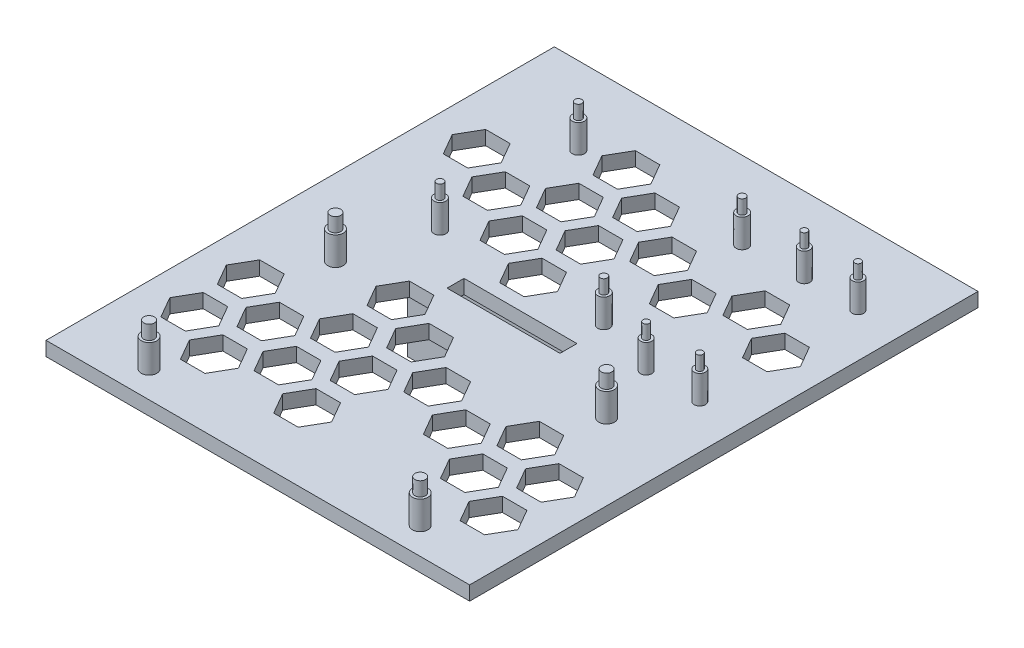
from build123d import *

# Parameters (mm, degrees)
ESQUISSE1_W                     = 62
ESQUISSE1_H                     = 12
ESQUISSE1_W_2                   = 58
ESQUISSE1_H_2                   = 8
BOSS_EXTRU_1_DEPTH              = 20
ESQUISSE2_R                     = 3.175
ENL_V_MAT_EXTRU_1_DEPTH         = 39.794329483
ESQUISSE3_W                     = 150
ESQUISSE3_H                     = 180
BOSS_EXTRU_2_DEPTH              = 5
ENL_V_MAT_EXTRU_3_REACH         = 120.849
ESQUISSE6_W                     = 40
ESQUISSE6_H                     = 6
ESQUISSE11_R                    = 2.75
BOSS_EXTRU_3_DEPTH              = 10
ESQUISSE13_R                    = 2
BOSS_EXTRU_4_DEPTH              = 10
ESQUISSE12_R                    = 2.125
BOSS_EXTRU_5_DEPTH              = 10
ESQUISSE10_R                    = 1.875
BOSS_EXTRU_6_DEPTH              = 15
ESQUISSE9_R                     = 1.125
BOSS_EXTRU_7_DEPTH              = 15
ESQUISSE8_R                     = 1.25
BOSS_EXTRU_8_DEPTH              = 15
ENL_V_MAT_EXTRU_4_DEPTH         = 120.791485507
R_P_TITION_LIN_AIRE1_COUNT      = 7
R_P_TITION_LIN_AIRE1_PITCH      = 20
R_P_TITION_LIN_AIRE1_COUNT_DIR2 = 4
R_P_TITION_LIN_AIRE1_PITCH_DIR2 = 33


with BuildPart() as part:
    # Esquisse1 → Boss.-Extru.1 (new body)
    with BuildSketch(Plane(origin=(0, 0, 0), x_dir=(1, 0, 0), z_dir=(0, 1, 0))):
        Rectangle(ESQUISSE1_W, ESQUISSE1_H)
        Rectangle(ESQUISSE1_W_2, ESQUISSE1_H_2, mode=Mode.SUBTRACT)
    extrude(amount=BOSS_EXTRU_1_DEPTH)

    # Esquisse2 → Enlèv. mat.-Extru.1 (cut, through all)
    with BuildSketch(Plane.XY.offset(6)):
        with Locations((0, 8)):
            Circle(ESQUISSE2_R)
    extrude(amount=-ENL_V_MAT_EXTRU_1_DEPTH, mode=Mode.SUBTRACT)

    # Esquisse3 → Boss.-Extru.2 (add)
    with BuildSketch(Plane(origin=(0, 20, 0), x_dir=(1, 0, 0), z_dir=(0, 1, 0))):
        Rectangle(ESQUISSE3_W, ESQUISSE3_H)
    extrude(amount=BOSS_EXTRU_2_DEPTH)

    # Esquisse6 → Enlèv. mat.-Extru.3 (cut, up to next)
    with BuildSketch(Plane(origin=(0, 20, 0), x_dir=(-1, 0, 0), z_dir=(0, -1, 0)), mode=Mode.PRIVATE) as enl_v_mat_extru_3_sk1:
        Rectangle(ESQUISSE6_W, ESQUISSE6_H)
    enl_v_mat_extru_3_tool1 = extrude(enl_v_mat_extru_3_sk1.sketch, amount=-ENL_V_MAT_EXTRU_3_REACH, mode=Mode.PRIVATE) & part.part
    add(enl_v_mat_extru_3_tool1.solids().sort_by_distance((0, 20, 0))[0], mode=Mode.SUBTRACT)

    # Esquisse11 → Boss.-Extru.3 (add)
    with BuildSketch(Plane(origin=(0, 25, 0), x_dir=(1, 0, 0), z_dir=(0, 1, 0))):
        with Locations((-48, -14.5)):
            Circle(ESQUISSE11_R)
        with Locations((-48, -80.5)):
            Circle(ESQUISSE11_R)
        with Locations((48, -14.5)):
            Circle(ESQUISSE11_R)
        with Locations((48, -80.5)):
            Circle(ESQUISSE11_R)
    extrude(amount=BOSS_EXTRU_3_DEPTH)

    # Esquisse13 → Boss.-Extru.4 (add)
    with BuildSketch(Plane(origin=(0, 25, 0), x_dir=(1, 0, 0), z_dir=(0, 1, 0))):
        with Locations((59.5, 7)):
            Circle(ESQUISSE13_R)
        with Locations((59.5, 63)):
            Circle(ESQUISSE13_R)
        with Locations((40.5, 7)):
            Circle(ESQUISSE13_R)
        with Locations((40.5, 63)):
            Circle(ESQUISSE13_R)
    extrude(amount=BOSS_EXTRU_4_DEPTH)

    # Esquisse12 → Boss.-Extru.5 (add)
    with BuildSketch(Plane(origin=(0, 25, 0), x_dir=(1, 0, 0), z_dir=(0, 1, 0))):
        with Locations((19, 62.5)):
            Circle(ESQUISSE12_R)
        with Locations((19, 13.5)):
            Circle(ESQUISSE12_R)
        with Locations((-39, 62.5)):
            Circle(ESQUISSE12_R)
        with Locations((-39, 13.5)):
            Circle(ESQUISSE12_R)
    extrude(amount=BOSS_EXTRU_5_DEPTH)

    # Esquisse10 → Boss.-Extru.6 (add)
    with BuildSketch(Plane(origin=(0, 25, 0), x_dir=(1, 0, 0), z_dir=(0, 1, 0))):
        with Locations((-48, -14.5)):
            Circle(ESQUISSE10_R)
        with Locations((48, -14.5)):
            Circle(ESQUISSE10_R)
        with Locations((-48, -80.5)):
            Circle(ESQUISSE10_R)
        with Locations((48, -80.5)):
            Circle(ESQUISSE10_R)
    extrude(amount=BOSS_EXTRU_6_DEPTH)

    # Esquisse9 → Boss.-Extru.7 (add)
    with BuildSketch(Plane(origin=(0, 25, 0), x_dir=(1, 0, 0), z_dir=(0, 1, 0))):
        with Locations((59.5, 63)):
            Circle(ESQUISSE9_R)
        with Locations((40.5, 63)):
            Circle(ESQUISSE9_R)
        with Locations((59.5, 7)):
            Circle(ESQUISSE9_R)
        with Locations((40.5, 7)):
            Circle(ESQUISSE9_R)
    extrude(amount=BOSS_EXTRU_7_DEPTH)

    # Esquisse8 → Boss.-Extru.8 (add)
    with BuildSketch(Plane(origin=(0, 25, 0), x_dir=(1, 0, 0), z_dir=(0, 1, 0))):
        with Locations((19, 62.5)):
            Circle(ESQUISSE8_R)
        with Locations((19, 13.5)):
            Circle(ESQUISSE8_R)
        with Locations((-39, 62.5)):
            Circle(ESQUISSE8_R)
        with Locations((-39, 13.5)):
            Circle(ESQUISSE8_R)
    extrude(amount=BOSS_EXTRU_8_DEPTH)

    # Esquisse14 → Enlèv. mat.-Extru.4 (cut, through all)
    with BuildSketch(Plane(origin=(0, 25, 0), x_dir=(1, 0, 0), z_dir=(0, 1, 0))):
        Polygon((-53.169872981, -62.5), (-48.839745962, -55), (-53.169872981, -47.5), (-61.830127019, -47.5), (-66.160254038, -55), (-61.830127019, -62.5), align=None)
        Polygon((-36.715390309, -72), (-32.38526329, -64.5), (-36.715390309, -57), (-45.375644347, -57), (-49.705771366, -64.5), (-45.375644347, -72), align=None)
    enl_v_mat_extru_4 = extrude(amount=-ENL_V_MAT_EXTRU_4_DEPTH, mode=Mode.SUBTRACT)

    # Répétition linéaire1: Enl_v. mat.-Extru.4 7 × 4, 14 skipped
    with Locations(*[(j * R_P_TITION_LIN_AIRE1_PITCH_DIR2, 0, -i * R_P_TITION_LIN_AIRE1_PITCH) for i in range(R_P_TITION_LIN_AIRE1_COUNT) for j in range(R_P_TITION_LIN_AIRE1_COUNT_DIR2) if (i, j) not in ((0, 0), (0, 2), (2, 0), (2, 2), (2, 3), (3, 0), (3, 1), (3, 2), (3, 3), (4, 0), (4, 2), (4, 3), (6, 0), (6, 2), (6, 3))]):
        add(enl_v_mat_extru_4, mode=Mode.SUBTRACT)


solid = part.part
